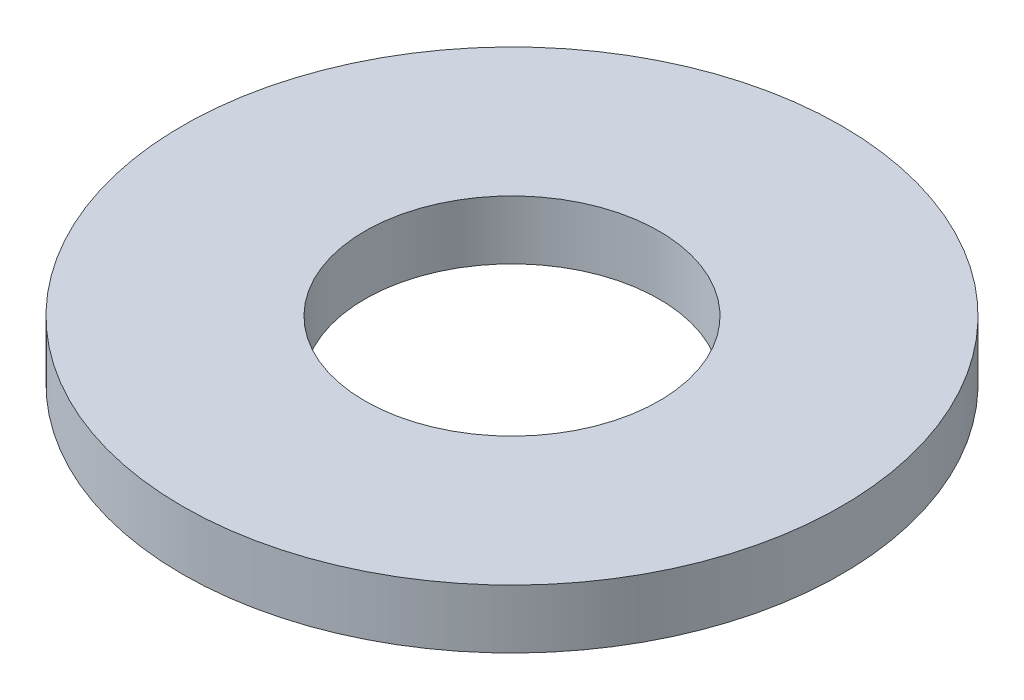
from build123d import *

# Parameters (mm, degrees)
SKETCH1_R           = 17.78
SKETCH1_R_2         = 7.9375
BOSS_EXTRUDE1_DEPTH = 3.175


with BuildPart() as part:
    # Sketch1 → Boss-Extrude1 (new body)
    with BuildSketch(Plane(origin=(0, 0, 0), x_dir=(1, 0, 0), z_dir=(0, 1, 0))):
        Circle(SKETCH1_R)
        Circle(SKETCH1_R_2, mode=Mode.SUBTRACT)
    extrude(amount=BOSS_EXTRUDE1_DEPTH)


solid = part.part
